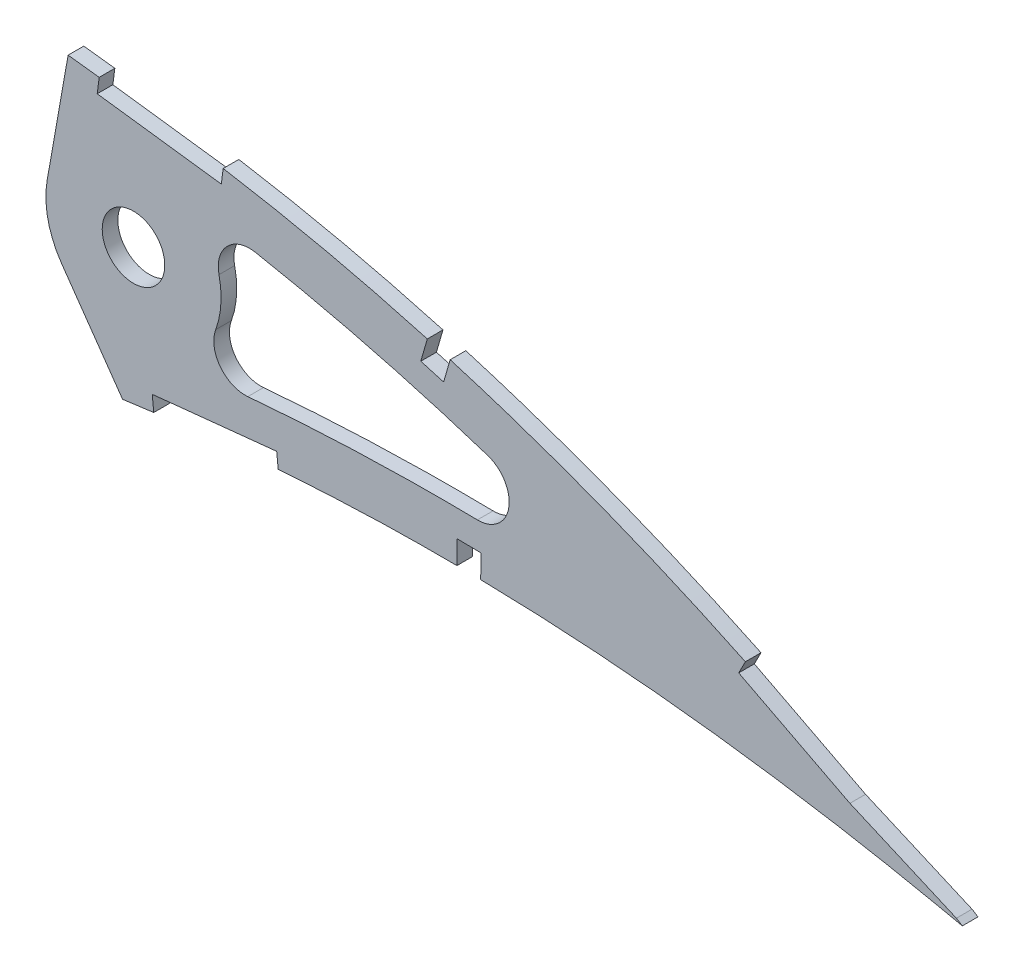
from build123d import *

# Parameters (mm, degrees)
BOSS_EXTRUDE1_DEPTH = 3.175
SKETCH4_R           = 6.35
CUT_EXTRUDE2_DEPTH  = 547.283591975
CUT_EXTRUDE3_DEPTH  = 7.62
FILLET1_R           = 6.35


with BuildPart() as part:
    # Sketch1 → Boss-Extrude1 (new body)
    with BuildSketch(Plane.XY):
        with BuildLine():
            Line((537.523793479, 0.838014197), (542.021387547, -1.940403701))
            Line((542.021387547, -1.940403701), (536.853382121, -0.838014197))
            add(Edge.make_bspline(
                [(0, 0), (0.138034208, -0.651613517), (0.414737006, -1.957835249), (1.166502385, -3.838253351), (2.160676214, -5.645879833), (3.41812392, -7.375913216), (4.930484677, -9.027880677), (6.694418268, -10.603500449), (8.708194811, -12.101925363), (10.969178631, -13.522473474), (13.474085311, -14.866652746), (16.220099339, -16.13362747), (19.204716902, -17.323001708), (22.424686182, -18.433185568), (25.876070677, -19.465869836), (29.555588987, -20.418537931), (33.459057132, -21.292521383), (37.582720715, -22.085589251), (41.922086221, -22.79854726), (46.47264566, -23.430996401), (51.229728203, -23.983332235), (56.188666796, -24.454395789), (61.344556547, -24.845200266), (66.692258515, -25.156004942), (72.226581781, -25.387795347), (77.942225046, -25.539690341), (83.833590491, -25.614057961), (89.895353971, -25.612014663), (96.121585635, -25.533013935), (102.506966812, -25.38142005), (109.045370018, -25.156272786), (115.730892393, -24.860296695), (122.557503504, -24.496470357), (129.519080627, -24.066027182), (136.609497338, -23.570874854), (143.822597201, -23.014984243), (151.151827785, -22.399741923), (158.590797026, -21.728733991), (166.132919157, -21.00531964), (173.771677913, -20.231788358), (181.500330731, -19.411778876), (189.311993833, -18.547948429), (197.200021897, -17.644905548), (205.157209236, -16.704284062), (213.176827191, -15.731454523), (221.251331322, -14.728275603), (229.373969711, -13.698611248), (237.537436822, -12.64730964), (245.734090261, -11.574250863), (253.957036061, -10.487080023), (262.198344279, -9.384901746), (270.450841426, -8.273384527), (278.706888239, -7.155983301), (286.958443262, -6.033041983), (295.198253093, -4.90921431), (303.41867388, -3.787585418), (311.611653564, -2.668257785), (319.769779667, -1.556794947), (327.884837197, -0.453060986), (335.949343265, 0.640706274), (343.955569803, 1.721242065), (351.895963319, 2.787182649), (359.762332786, 3.837853602), (367.54676401, 4.873649521), (375.124885566, 5.86313137), (382.476895799, 6.858989414), (389.627569535, 7.675372288), (396.689208318, 8.372184453), (403.669147402, 8.943474279), (410.559005462, 9.397460881), (417.35088821, 9.737388222), (424.036701118, 9.968002084), (430.607999049, 10.096143944), (437.056574293, 10.125065717), (443.373624814, 10.063990775), (449.550934642, 9.917842246), (455.579882304, 9.693180036), (461.452056886, 9.397583865), (467.159117519, 9.039111896), (472.692496198, 8.623051856), (478.044482343, 8.159116909), (483.20681867, 7.654098497), (488.171578303, 7.113766584), (492.931516981, 6.549443229), (497.479015862, 5.964843963), (501.807234808, 5.369575836), (505.909206574, 4.769671288), (509.778434754, 4.172789296), (513.408840214, 3.584624041), (516.794558715, 3.012982056), (519.930286636, 2.463204222), (522.810582624, 1.940659579), (525.431450895, 1.451941159), (527.787715212, 0.999476696), (529.876224241, 0.590722876), (531.693094624, 0.227483345), (533.235662954, -0.085124276), (534.501235327, -0.345866251), (535.487889575, -0.550462297), (536.193676878, -0.699239352), (536.617833842, -0.78776929), (536.806292235, -0.827969433), (536.853382121, -0.838014197)],
                knots=[0, 0, 0, 0, 0.003638255, 0.007293231, 0.011028136, 0.014901081, 0.018963272, 0.023258475, 0.027820626, 0.032679082, 0.03785316, 0.043361875, 0.049214679, 0.055422346, 0.061988786, 0.068918036, 0.076211157, 0.083868392, 0.091887411, 0.100265912, 0.108999867, 0.118084529, 0.127514843, 0.13728527, 0.147387917, 0.157816481, 0.168563473, 0.179619128, 0.190977373, 0.202626974, 0.214560478, 0.226767249, 0.239236417, 0.251959004, 0.264923894, 0.278119703, 0.291536035, 0.30516028, 0.318980685, 0.332985499, 0.34716279, 0.361498603, 0.375980747, 0.390597192, 0.405332593, 0.420174823, 0.435109533, 0.450124276, 0.465203068, 0.480333154, 0.495500583, 0.510689775, 0.525887334, 0.541078314, 0.556247233, 0.571381784, 0.58646604, 0.601484516, 0.616424329, 0.631269422, 0.646006524, 0.660620684, 0.675098187, 0.689422858, 0.703581825, 0.716907563, 0.730009274, 0.742952128, 0.755725558, 0.768319952, 0.780724337, 0.792926529, 0.804916041, 0.816679084, 0.828203524, 0.8394749, 0.850481359, 0.861207697, 0.871639326, 0.881763414, 0.891563605, 0.901027364, 0.910138977, 0.918883976, 0.927249278, 0.935221104, 0.942784739, 0.949928188, 0.956638464, 0.962904203, 0.968712288, 0.974054485, 0.978918432, 0.983297218, 0.987180246, 0.990560674, 0.993433357, 0.995790626, 0.997629587, 0.998945816, 0.999736592, 1, 1, 1, 1], degree=3))
            add(Edge.make_bspline(
                [(537.523793479, 0.838014197), (537.482615732, 0.863452017), (537.318064528, 0.96510459), (536.947300697, 1.192526083), (536.329901806, 1.57130801), (535.46559731, 2.098819483), (534.355058257, 2.773659514), (532.997726083, 3.59110281), (531.394448119, 4.54849361), (529.545612388, 5.641303796), (527.451408281, 6.86441657), (525.112633224, 8.21287684), (522.529490774, 9.679050377), (519.702981637, 11.256946414), (516.634075426, 12.939060426), (513.323352771, 14.717795209), (509.771999152, 16.584102922), (505.981377851, 18.529956506), (501.952179943, 20.544610393), (497.686305121, 22.619680198), (493.18517462, 24.744819484), (488.450324771, 26.908690342), (483.484475652, 29.10247161), (478.289000223, 31.312524792), (472.866859293, 33.529274563), (467.220361199, 35.74010496), (461.352849174, 37.93494721), (455.266586971, 40.099582697), (448.966124199, 42.224551766), (442.454517235, 44.29604992), (435.736422737, 46.30282705), (428.815744024, 48.23187216), (421.698250245, 50.073291993), (414.388455333, 51.81367658), (406.892554856, 53.441376499), (399.216507212, 54.946591973), (391.366750067, 56.314295462), (383.365035839, 57.543420661), (375.340110277, 58.565844722), (367.331695381, 59.568608396), (359.33520696, 60.510613179), (351.240984711, 61.412713021), (343.056815752, 62.269828969), (334.790818119, 63.079280807), (326.451359929, 63.837575043), (318.047107413, 64.542487925), (309.586192901, 65.190025104), (301.077537968, 65.77918901), (292.529554555, 66.304800113), (283.951347283, 66.766463817), (275.351624178, 67.160960307), (266.739334656, 67.485571411), (258.123623749, 67.738337522), (249.513434854, 67.916837067), (240.918090619, 68.019947775), (232.346531537, 68.044852228), (223.808075907, 67.9911049), (215.311664889, 67.856860342), (206.866626287, 67.640280799), (198.481913458, 67.340962045), (190.166593165, 66.959033914), (181.929769837, 66.491298026), (173.780378961, 65.940735117), (165.727495548, 65.305032423), (157.779967433, 64.584020875), (149.9461237, 63.780705916), (142.234686098, 62.892902653), (134.653918954, 61.923137139), (127.2121141, 60.873310758), (119.917621446, 59.742851607), (112.778255016, 58.535025019), (105.801720226, 57.251066746), (98.995398233, 55.894740955), (92.366699314, 54.466401509), (85.922640298, 52.970332999), (79.66991824, 51.40914198), (73.615254674, 49.785686485), (67.764787279, 48.103862095), (62.124432152, 46.36748437), (56.700764602, 44.578461264), (51.497883725, 42.743575913), (46.522180738, 40.864130885), (41.777467174, 38.945916209), (37.269303476, 36.991551041), (33.001057421, 35.006993284), (28.977559684, 32.994502304), (25.201677836, 30.959716413), (21.67720255, 28.905755725), (18.407526536, 26.836435266), (15.394024003, 24.75700399), (12.640849753, 22.668767086), (10.148949542, 20.577001449), (7.919900318, 18.484892293), (5.956888292, 16.393880779), (4.259842806, 14.307649188), (2.830987907, 12.227849748), (1.670571486, 10.156450442), (0.781218216, 8.094955971), (0.162046196, 6.044525665), (-0.176884415, 4.008185904), (-0.261246296, 1.984304191), (-0.086951983, 0.66044643), (0, 0)],
                knots=[0, 0, 0, 0, 0.00025409, 0.001015373, 0.002283359, 0.004056577, 0.006330982, 0.009105274, 0.012374489, 0.016134023, 0.02037966, 0.025105976, 0.030306237, 0.035972206, 0.042099522, 0.048678064, 0.055701664, 0.063160184, 0.071045824, 0.079349827, 0.08806291, 0.097175756, 0.106678112, 0.116561573, 0.126814276, 0.137428301, 0.148393618, 0.15969976, 0.171338126, 0.183297699, 0.195569604, 0.208143555, 0.221011593, 0.234161831, 0.24758745, 0.261276822, 0.27522271, 0.289414144, 0.3037712, 0.317689227, 0.331784111, 0.346039677, 0.360443869, 0.37498272, 0.389640454, 0.404403317, 0.419256601, 0.434186749, 0.449177265, 0.464214782, 0.479284009, 0.49436974, 0.509457833, 0.524532346, 0.53957932, 0.554582984, 0.569529546, 0.584403417, 0.599190992, 0.613876838, 0.628447475, 0.642888675, 0.657186054, 0.671325546, 0.685294014, 0.699078147, 0.712665095, 0.726042645, 0.739197713, 0.752117586, 0.764792042, 0.777208152, 0.789355685, 0.80122396, 0.812803686, 0.824082909, 0.835054602, 0.845709571, 0.856037853, 0.866033834, 0.875688843, 0.884997719, 0.893953426, 0.902552897, 0.910789386, 0.918660734, 0.926166253, 0.933302626, 0.94007122, 0.94647478, 0.952517526, 0.958204819, 0.963546652, 0.9685566, 0.973249913, 0.977651041, 0.981787043, 0.985694226, 0.989415109, 0.993001157, 0.996508416, 1, 1, 1, 1], degree=3))
        make_face()
    extrude(amount=BOSS_EXTRUDE1_DEPTH)

    # Sketch4 → Cut-Extrude2 (cut, through all)
    with BuildSketch(Plane(origin=(0, 0, 0), x_dir=(-1, 0, 0), z_dir=(0, 0, -1))):
        with BuildLine():
            ThreePointArc((-356.286959494, 36.320039485), (-356.438298336, 29.38427855), (-359.232317995, 23.034385848))
            Line((-359.232317995, 23.034385848), (-371.579512679, 5.400764372))
            add(Edge.make_bspline(
                [(0, 0), (-0.138034208, -0.651613517), (-0.414737006, -1.957835249), (-1.166502385, -3.838253351), (-2.160676214, -5.645879833), (-3.41812392, -7.375913216), (-4.930484677, -9.027880677), (-6.694418268, -10.603500449), (-8.708194811, -12.101925363), (-10.969178631, -13.522473474), (-13.474085311, -14.866652746), (-16.220099339, -16.13362747), (-19.204716902, -17.323001708), (-22.424686182, -18.433185568), (-25.876070677, -19.465869836), (-29.555588987, -20.418537931), (-33.459057132, -21.292521383), (-37.582720715, -22.085589251), (-41.922086221, -22.79854726), (-46.47264566, -23.430996401), (-51.229728203, -23.983332235), (-56.188666796, -24.454395789), (-61.344556547, -24.845200266), (-66.692258515, -25.156004942), (-72.226581781, -25.387795347), (-77.942225046, -25.539690341), (-83.833590491, -25.614057961), (-89.895353971, -25.612014663), (-96.121585635, -25.533013935), (-102.506966812, -25.38142005), (-109.045370018, -25.156272786), (-115.730892393, -24.860296695), (-122.557503504, -24.496470357), (-129.519080627, -24.066027182), (-136.609497338, -23.570874854), (-143.822597201, -23.014984243), (-151.151827785, -22.399741923), (-158.590797026, -21.728733991), (-166.132919157, -21.00531964), (-173.771677913, -20.231788358), (-181.500330731, -19.411778876), (-189.311993833, -18.547948429), (-197.200021897, -17.644905548), (-205.157209236, -16.704284062), (-213.176827191, -15.731454523), (-221.251331322, -14.728275603), (-229.373969711, -13.698611248), (-237.537436822, -12.64730964), (-245.734090261, -11.574250863), (-253.957036061, -10.487080023), (-262.198344279, -9.384901746), (-270.450841426, -8.273384527), (-278.706888239, -7.155983301), (-286.958443262, -6.033041983), (-295.198253093, -4.90921431), (-303.41867388, -3.787585418), (-311.611653564, -2.668257785), (-319.769779667, -1.556794947), (-327.884837197, -0.453060986), (-335.949343265, 0.640706274), (-343.955569803, 1.721242065), (-351.895963319, 2.787182649), (-359.762332786, 3.837853602), (-366.315041689, 4.709756628), (-370.245412424, 5.225282692), (-371.579512679, 5.400764372)],
                knots=[0, 0, 0, 0, 0.003638255, 0.007293231, 0.011028136, 0.014901081, 0.018963272, 0.023258475, 0.027820626, 0.032679082, 0.03785316, 0.043361875, 0.049214679, 0.055422346, 0.061988786, 0.068918036, 0.076211157, 0.083868392, 0.091887411, 0.100265912, 0.108999867, 0.118084529, 0.127514843, 0.13728527, 0.147387917, 0.157816481, 0.168563473, 0.179619128, 0.190977373, 0.202626974, 0.214560478, 0.226767249, 0.239236417, 0.251959004, 0.264923894, 0.278119703, 0.291536035, 0.30516028, 0.318980685, 0.332985499, 0.34716279, 0.361498603, 0.375980747, 0.390597192, 0.405332593, 0.420174823, 0.435109533, 0.450124276, 0.465203068, 0.480333154, 0.495500583, 0.510689775, 0.525887334, 0.541078314, 0.556247233, 0.571381784, 0.58646604, 0.601484516, 0.616424329, 0.631269422, 0.646006524, 0.660620684, 0.675098187, 0.689422858, 0.696784129, 0.696784129, 0.696784129, 0.696784129], degree=3))
            add(Edge.make_bspline(
                [(-360.526726967, 60.364955673), (-360.13939216, 60.409720829), (-357.05430612, 60.764819232), (-351.240984711, 61.412713021), (-343.056815752, 62.269828969), (-334.790818119, 63.079280807), (-326.451359929, 63.837575043), (-318.047107413, 64.542487925), (-309.586192901, 65.190025104), (-301.077537968, 65.77918901), (-292.529554555, 66.304800113), (-283.951347283, 66.766463817), (-275.351624178, 67.160960307), (-266.739334656, 67.485571411), (-258.123623749, 67.738337522), (-249.513434854, 67.916837067), (-240.918090619, 68.019947775), (-232.346531537, 68.044852228), (-223.808075907, 67.9911049), (-215.311664889, 67.856860342), (-206.866626287, 67.640280799), (-198.481913458, 67.340962045), (-190.166593165, 66.959033914), (-181.929769837, 66.491298026), (-173.780378961, 65.940735117), (-165.727495548, 65.305032423), (-157.779967433, 64.584020875), (-149.9461237, 63.780705916), (-142.234686098, 62.892902653), (-134.653918954, 61.923137139), (-127.2121141, 60.873310758), (-119.917621446, 59.742851607), (-112.778255016, 58.535025019), (-105.801720226, 57.251066746), (-98.995398233, 55.894740955), (-92.366699314, 54.466401509), (-85.922640298, 52.970332999), (-79.66991824, 51.40914198), (-73.615254674, 49.785686485), (-67.764787279, 48.103862095), (-62.124432152, 46.36748437), (-56.700764602, 44.578461264), (-51.497883725, 42.743575913), (-46.522180738, 40.864130885), (-41.777467174, 38.945916209), (-37.269303476, 36.991551041), (-33.001057421, 35.006993284), (-28.977559684, 32.994502304), (-25.201677836, 30.959716413), (-21.67720255, 28.905755725), (-18.407526536, 26.836435266), (-15.394024003, 24.75700399), (-12.640849753, 22.668767086), (-10.148949542, 20.577001449), (-7.919900318, 18.484892293), (-5.956888292, 16.393880779), (-4.259842806, 14.307649188), (-2.830987907, 12.227849748), (-1.670571486, 10.156450442), (-0.781218216, 8.094955971), (-0.162046196, 6.044525665), (0.176884415, 4.008185904), (0.261246296, 1.984304191), (0.086951983, 0.66044643), (0, 0)],
                knots=[0.329737216, 0.329737216, 0.329737216, 0.329737216, 0.331784111, 0.346039677, 0.360443869, 0.37498272, 0.389640454, 0.404403317, 0.419256601, 0.434186749, 0.449177265, 0.464214782, 0.479284009, 0.49436974, 0.509457833, 0.524532346, 0.53957932, 0.554582984, 0.569529546, 0.584403417, 0.599190992, 0.613876838, 0.628447475, 0.642888675, 0.657186054, 0.671325546, 0.685294014, 0.699078147, 0.712665095, 0.726042645, 0.739197713, 0.752117586, 0.764792042, 0.777208152, 0.789355685, 0.80122396, 0.812803686, 0.824082909, 0.835054602, 0.845709571, 0.856037853, 0.866033834, 0.875688843, 0.884997719, 0.893953426, 0.902552897, 0.910789386, 0.918660734, 0.926166253, 0.933302626, 0.94007122, 0.94647478, 0.952517526, 0.958204819, 0.963546652, 0.9685566, 0.973249913, 0.977651041, 0.981787043, 0.985694226, 0.989415109, 0.993001157, 0.996508416, 1, 1, 1, 1], degree=3))
            Line((-360.526726967, 60.364955673), (-356.286959494, 36.320039485))
        make_face()
        with Locations((-373.796841343, 33.232574886)):
            Circle(SKETCH4_R)
        with BuildLine():
            ThreePointArc((-391.576841343, 33.232574886), (-389.864229199, 40.846210514), (-385.056318566, 46.99311894))
            add(Edge.make_bspline(
                [(-483.945277453, 17.782093716), (-479.37869056, 19.828738879), (-464.101486778, 26.335024231), (-442.96941175, 33.791006158), (-420.638573326, 39.978517334), (-406.51494969, 43.196118714), (-395.153069217, 45.36374072), (-388.916755362, 46.409790636), (-385.561376483, 46.917807663), (-385.056318566, 46.99311894)],
                knots=[0.097967511, 0.097967511, 0.097967511, 0.097967511, 0.124904445, 0.187356668, 0.218582779, 0.249808891, 0.265421946, 0.281035002, 0.283801476, 0.283801476, 0.283801476, 0.283801476], degree=3))
            add(Edge.make_bspline(
                [(-380.708136876, 16.850804711), (-381.278127665, 16.922778664), (-383.305182899, 17.174627253), (-386.786120963, 17.575507047), (-392.58278563, 18.187634312), (-402.773771505, 19.115011682), (-417.34679611, 20.003093808), (-440.709649319, 20.51010277), (-462.937810441, 19.701213451), (-479.254342954, 18.263445051), (-483.945277453, 17.782093716)],
                knots=[0.715911003, 0.715911003, 0.715911003, 0.715911003, 0.718973956, 0.726780235, 0.734586514, 0.750199072, 0.781424188, 0.812649304, 0.875099536, 0.900362401, 0.900362401, 0.900362401, 0.900362401], degree=3))
            ThreePointArc((-380.708136876, 16.850804711), (-388.612563306, 23.402886045), (-391.576841343, 33.232574886))
        make_face()
    extrude(amount=-CUT_EXTRUDE2_DEPTH, mode=Mode.SUBTRACT)

    # Sketch5 → Cut-Extrude3 (cut)
    with BuildSketch(Plane.XY.offset(3.175)):
        Polygon((392.026401536, 56.390657128), (366.842305925, 59.674265489), (366.43185488, 56.526253538), (391.615950491, 53.242645177), align=None)
        Polygon((402.855659038, 11.892356637), (377.596720263, 9.282624876), (377.922936734, 6.12525753), (403.181875508, 8.734989291), align=None)
        Polygon((438.08047255, 45.648806451), (433.445232123, 46.987621362), (432.106417212, 42.352380934), (436.741657639, 41.013566024), align=None)
        Polygon((444.326796582, 14.772026559), (439.502338831, 14.836452782), (439.437912607, 10.011995031), (444.262370359, 9.947568807), align=None)
        Polygon((520.560283096, 11.064042442), (498.077277501, 22.652570205), (496.62265431, 19.830442838), (519.199673242, 8.193457312), (542.497437426, -1.924455793), (543.762176564, 0.98776473), align=None)
    extrude(amount=-CUT_EXTRUDE3_DEPTH, mode=Mode.SUBTRACT)


with BuildPart() as body_2:
    # of the pieces the cut leaves, the one that is kept (cut_extrude3_keep)
    add(part.part.solids().sort_by_distance((540.807616413, -1.190588713, 0))[0])

    # Fillet1
    fillet1_edges = [body_2.edges().sort_by_distance(p)[0] for p in [
        (483.945277453, 17.782093716, 1.5875),
        (380.708136876, 16.850804711, 1.5875),
        (385.056318566, 46.99311894, 1.5875),
    ]]
    fillet(fillet1_edges, radius=FILLET1_R)


solid = body_2.part
